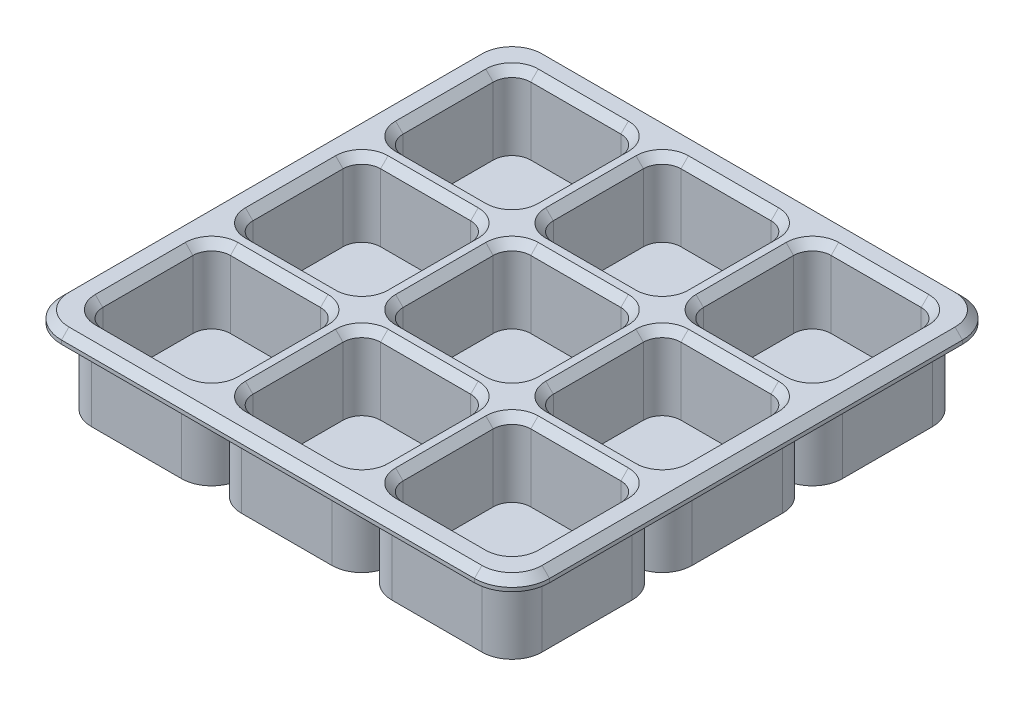
from build123d import *

# Parameters (mm, degrees)
CROQUIS2_W              = 130
CROQUIS2_H              = 130
SALIENTE_EXTRUIR1_DEPTH = 60
CORTAR_EXTRUIR1_DEPTH   = 20
MATRIZL1_COUNT          = 3
MATRIZL1_PITCH          = 40
MATRIZL1_COUNT_DIR2     = 3
MATRIZL1_PITCH_DIR2     = 40
REDONDEO1_R             = 10
VACIADO3_START          = -60
VACIADO3_DEPTH          = 37
VACIADO3_START_2        = -23
VACIADO3_2_DEPTH        = 20
CHAFL_N1_SIZE           = 2
CHAFL_N2_SIZE           = 2
CROQUIS5_R              = 3.5
CORTAR_EXTRUIR3_DEPTH   = 60
MATRIZL2_COUNT          = 3
MATRIZL2_PITCH          = 40
MATRIZL2_COUNT_DIR2     = 3
MATRIZL2_PITCH_DIR2     = 40
CORTAR_EXTRUIR2_DEPTH   = 35


# Read off the part's stored shape, not the designer's step: Vaciado3
with BuildPart() as part:
    # Croquis2 → Saliente-Extruir1 (new body)
    with BuildSketch(Plane(origin=(0, 0, 0), x_dir=(1, 0, 0), z_dir=(0, 1, 0))):
        Rectangle(CROQUIS2_W, CROQUIS2_H)
    extrude(amount=-SALIENTE_EXTRUIR1_DEPTH)

    # Croquis3 → Cortar-Extruir1 (cut)
    with BuildSketch(Plane(origin=(0, 0, 0), x_dir=(1, 0, 0), z_dir=(0, 1, 0))):
        with BuildLine():
            Line((-52, 57), (-28, 57))
            ThreePointArc((-28, 57), (-24.464466094, 55.535533906), (-23, 52))
            Line((-23, 52), (-23, 28))
            ThreePointArc((-23, 28), (-24.464466094, 24.464466094), (-28, 23))
            Line((-28, 23), (-52, 23))
            ThreePointArc((-52, 23), (-55.535533906, 24.464466094), (-57, 28))
            Line((-57, 28), (-57, 52))
            ThreePointArc((-57, 52), (-55.535533906, 55.535533906), (-52, 57))
        make_face()
    cortar_extruir1 = extrude(amount=-CORTAR_EXTRUIR1_DEPTH, mode=Mode.SUBTRACT)

    # MatrizL1: Cortar-Extruir1 3 × 3
    with Locations(*[(i * MATRIZL1_PITCH, 0, j * MATRIZL1_PITCH_DIR2) for i in range(MATRIZL1_COUNT) for j in range(MATRIZL1_COUNT_DIR2) if (i, j) != (0, 0)]):
        add(cortar_extruir1, mode=Mode.SUBTRACT)

    # Redondeo1
    redondeo1_edges = [part.edges().sort_by_distance(p)[0] for p in [
        (65, -30, 65),
        (-65, -30, 65),
        (-65, -30, -65),
        (65, -30, -65),
    ]]
    fillet(redondeo1_edges, radius=REDONDEO1_R)

    # Vaciado3 outline → Vaciado3 (cut)
    with BuildSketch(Plane(origin=(0, 0, 0), x_dir=(1, 0, 0), z_dir=(0, 1, 0)).offset(VACIADO3_START)):
        with BuildLine():
            ThreePointArc((55, -65), (62.071067812, -62.071067812), (65, -55))
            Line((65, -55), (65, 55))
            ThreePointArc((65, 55), (62.071067812, 62.071067812), (55, 65))
            Line((55, 65), (-55, 65))
            ThreePointArc((-55, 65), (-62.071067812, 62.071067812), (-65, 55))
            Line((-65, 55), (-65, -55))
            ThreePointArc((-65, -55), (-62.071067812, -62.071067812), (-55, -65))
            Line((-55, -65), (55, -65))
        make_face()
    extrude(amount=VACIADO3_DEPTH, mode=Mode.SUBTRACT)

    # Vaciado3 2 outline → Vaciado3 2 (cut)
    # profile 1 of 5: a face of its own
    with BuildSketch(Plane(origin=(0, 0, 0), x_dir=(1, 0, 0), z_dir=(0, 1, 0)).offset(VACIADO3_START_2)):
        with BuildLine():
            ThreePointArc((55, -65), (62.071067812, -62.071067812), (65, -55))
            Line((65, -55), (65, 55))
            ThreePointArc((65, 55), (62.071067812, 62.071067812), (55, 65))
            Line((55, 65), (-55, 65))
            ThreePointArc((-55, 65), (-62.071067812, 62.071067812), (-65, 55))
            Line((-65, 55), (-65, -55))
            ThreePointArc((-65, -55), (-62.071067812, -62.071067812), (-55, -65))
            Line((-55, -65), (55, -65))
        make_face()
        with BuildLine():
            ThreePointArc((-60, 52), (-57.656854249, 57.656854249), (-52, 60))
            Line((-52, 60), (-28, 60))
            ThreePointArc((-28, 60), (-22.343145751, 57.656854249), (-20, 52))
            ThreePointArc((-20, 52), (-17.656854249, 57.656854249), (-12, 60))
            Line((-12, 60), (12, 60))
            ThreePointArc((12, 60), (17.656854249, 57.656854249), (20, 52))
            ThreePointArc((20, 52), (22.343145751, 57.656854249), (28, 60))
            Line((28, 60), (52, 60))
            ThreePointArc((52, 60), (57.656854249, 57.656854249), (60, 52))
            Line((60, 52), (60, 28))
            ThreePointArc((60, 28), (57.656854249, 22.343145751), (52, 20))
            ThreePointArc((52, 20), (57.656854249, 17.656854249), (60, 12))
            Line((60, 12), (60, -12))
            ThreePointArc((60, -12), (57.656854249, -17.656854249), (52, -20))
            ThreePointArc((52, -20), (57.656854249, -22.343145751), (60, -28))
            Line((60, -28), (60, -52))
            ThreePointArc((60, -52), (57.656854249, -57.656854249), (52, -60))
            Line((52, -60), (28, -60))
            ThreePointArc((28, -60), (22.343145751, -57.656854249), (20, -52))
            ThreePointArc((20, -52), (17.656854249, -57.656854249), (12, -60))
            Line((12, -60), (-12, -60))
            ThreePointArc((-12, -60), (-17.656854249, -57.656854249), (-20, -52))
            ThreePointArc((-20, -52), (-22.343145751, -57.656854249), (-28, -60))
            Line((-28, -60), (-52, -60))
            ThreePointArc((-52, -60), (-57.656854249, -57.656854249), (-60, -52))
            Line((-60, -52), (-60, -28))
            ThreePointArc((-60, -28), (-57.656854249, -22.343145751), (-52, -20))
            ThreePointArc((-52, -20), (-57.656854249, -17.656854249), (-60, -12))
            Line((-60, -12), (-60, 12))
            ThreePointArc((-60, 12), (-57.656854249, 17.656854249), (-52, 20))
            ThreePointArc((-52, 20), (-57.656854249, 22.343145751), (-60, 28))
            Line((-60, 28), (-60, 52))
        make_face(mode=Mode.SUBTRACT)
    # profile 2 of 5: a face of its own
    with BuildSketch(Plane(origin=(0, 0, 0), x_dir=(1, 0, 0), z_dir=(0, 1, 0)).offset(VACIADO3_START_2)):
        with BuildLine():
            ThreePointArc((20, -12), (17.656854249, -17.656854249), (12, -20))
            ThreePointArc((12, -20), (17.656854249, -22.343145751), (20, -28))
            ThreePointArc((20, -28), (22.343145751, -22.343145751), (28, -20))
            ThreePointArc((28, -20), (22.343145751, -17.656854249), (20, -12))
        make_face()
    # profile 3 of 5: a face of its own
    with BuildSketch(Plane(origin=(0, 0, 0), x_dir=(1, 0, 0), z_dir=(0, 1, 0)).offset(VACIADO3_START_2)):
        with BuildLine():
            ThreePointArc((-20, -12), (-22.343145751, -17.656854249), (-28, -20))
            ThreePointArc((-28, -20), (-22.343145751, -22.343145751), (-20, -28))
            ThreePointArc((-20, -28), (-17.656854249, -22.343145751), (-12, -20))
            ThreePointArc((-12, -20), (-17.656854249, -17.656854249), (-20, -12))
        make_face()
    # profile 4 of 5: a face of its own
    with BuildSketch(Plane(origin=(0, 0, 0), x_dir=(1, 0, 0), z_dir=(0, 1, 0)).offset(VACIADO3_START_2)):
        with BuildLine():
            ThreePointArc((20, 28), (17.656854249, 22.343145751), (12, 20))
            ThreePointArc((12, 20), (17.656854249, 17.656854249), (20, 12))
            ThreePointArc((20, 12), (22.343145751, 17.656854249), (28, 20))
            ThreePointArc((28, 20), (22.343145751, 22.343145751), (20, 28))
        make_face()
    # profile 5 of 5: a face of its own
    with BuildSketch(Plane(origin=(0, 0, 0), x_dir=(1, 0, 0), z_dir=(0, 1, 0)).offset(VACIADO3_START_2)):
        with BuildLine():
            ThreePointArc((-20, 28), (-22.343145751, 22.343145751), (-28, 20))
            ThreePointArc((-28, 20), (-22.343145751, 17.656854249), (-20, 12))
            ThreePointArc((-20, 12), (-17.656854249, 17.656854249), (-12, 20))
            ThreePointArc((-12, 20), (-17.656854249, 22.343145751), (-20, 28))
        make_face()
    extrude(amount=VACIADO3_2_DEPTH, mode=Mode.SUBTRACT)

    # Chaflán1
    chafl_n1_edges = [part.edges().sort_by_distance(p)[0] for p in [
        (0, 0, -65),
        (65, 0, 0),
        (-65, 0, 0),
        (0, 0, 65),
        (-62.071067812, 0, 62.071067812),
        (62.071067812, 0, 62.071067812),
        (62.071067812, 0, -62.071067812),
        (-62.071067812, 0, -62.071067812),
    ]]
    chamfer(chafl_n1_edges, length=CHAFL_N1_SIZE)

    # Chaflán2
    chafl_n2_edges = [part.edges().sort_by_distance(p)[0] for p in [
        (24.464466094, 0, -15.535533906),
        (23, 0, 0),
        (24.464466094, 0, 15.535533906),
        (40, 0, 17),
        (55.535533906, 0, 15.535533906),
        (57, 0, 0),
        (55.535533906, 0, -15.535533906),
        (40, 0, -17),
        (-55.535533906, 0, 24.464466094),
        (-57, 0, 40),
        (-55.535533906, 0, 55.535533906),
        (-40, 0, 57),
        (-24.464466094, 0, 55.535533906),
        (-23, 0, 40),
        (-24.464466094, 0, 24.464466094),
        (-40, 0, 23),
        (-15.535533906, 0, 24.464466094),
        (-17, 0, 40),
        (-15.535533906, 0, 55.535533906),
        (0, 0, 57),
        (15.535533906, 0, 55.535533906),
        (17, 0, 40),
        (15.535533906, 0, 24.464466094),
        (0, 0, 23),
        (24.464466094, 0, 24.464466094),
        (23, 0, 40),
        (24.464466094, 0, 55.535533906),
        (40, 0, 57),
        (55.535533906, 0, 55.535533906),
        (57, 0, 40),
        (55.535533906, 0, 24.464466094),
        (40, 0, 23),
        (-55.535533906, 0, -55.535533906),
        (-57, 0, -40),
        (-55.535533906, 0, -24.464466094),
        (-40, 0, -23),
        (-24.464466094, 0, -24.464466094),
        (-23, 0, -40),
        (-24.464466094, 0, -55.535533906),
        (-40, 0, -57),
        (-15.535533906, 0, -55.535533906),
        (-17, 0, -40),
        (-15.535533906, 0, -24.464466094),
        (0, 0, -23),
        (15.535533906, 0, -24.464466094),
        (17, 0, -40),
        (15.535533906, 0, -55.535533906),
        (0, 0, -57),
        (24.464466094, 0, -55.535533906),
        (23, 0, -40),
        (24.464466094, 0, -24.464466094),
        (40, 0, -23),
        (55.535533906, 0, -24.464466094),
        (57, 0, -40),
        (55.535533906, 0, -55.535533906),
        (40, 0, -57),
        (-55.535533906, 0, -15.535533906),
        (-57, 0, 0),
        (-55.535533906, 0, 15.535533906),
        (-40, 0, 17),
        (-24.464466094, 0, 15.535533906),
        (-23, 0, 0),
        (-24.464466094, 0, -15.535533906),
        (-40, 0, -17),
        (-15.535533906, 0, -15.535533906),
        (-17, 0, 0),
        (-15.535533906, 0, 15.535533906),
        (0, 0, 17),
        (15.535533906, 0, 15.535533906),
        (17, 0, 0),
        (15.535533906, 0, -15.535533906),
        (0, 0, -17),
    ]]
    chamfer(chafl_n2_edges, length=CHAFL_N2_SIZE)

    # Croquis5 → Cortar-Extruir3 (cut)
    with BuildSketch(Plane(origin=(0, 0, 0), x_dir=(1, 0, 0), z_dir=(0, 1, 0))):
        with Locations(Location((-40, 40, 0), (0, 0, 90))):
            Circle(CROQUIS5_R)
    cortar_extruir3 = extrude(amount=-CORTAR_EXTRUIR3_DEPTH, mode=Mode.SUBTRACT)

    # MatrizL2: Cortar-Extruir3 3 × 3
    with Locations(*[(i * MATRIZL2_PITCH, 0, j * MATRIZL2_PITCH_DIR2) for i in range(MATRIZL2_COUNT) for j in range(MATRIZL2_COUNT_DIR2) if (i, j) != (0, 0)]):
        add(cortar_extruir3, mode=Mode.SUBTRACT)

    # Croquis4 → Cortar-Extruir2 (cut)
    with BuildSketch(Plane.XZ.offset(60)):
        with BuildLine():
            Line((-62, 55), (-62, -55))
            ThreePointArc((-62, -55), (-59.949747468, -59.949747468), (-55, -62))
            Line((-55, -62), (55, -62))
            ThreePointArc((55, -62), (59.949747468, -59.949747468), (62, -55))
            Line((62, -55), (62, 55))
            ThreePointArc((62, 55), (59.949747468, 59.949747468), (55, 62))
            Line((55, 62), (-55, 62))
            ThreePointArc((-55, 62), (-59.949747468, 59.949747468), (-62, 55))
        make_face()
    extrude(amount=-CORTAR_EXTRUIR2_DEPTH, mode=Mode.SUBTRACT)


solid = part.part
